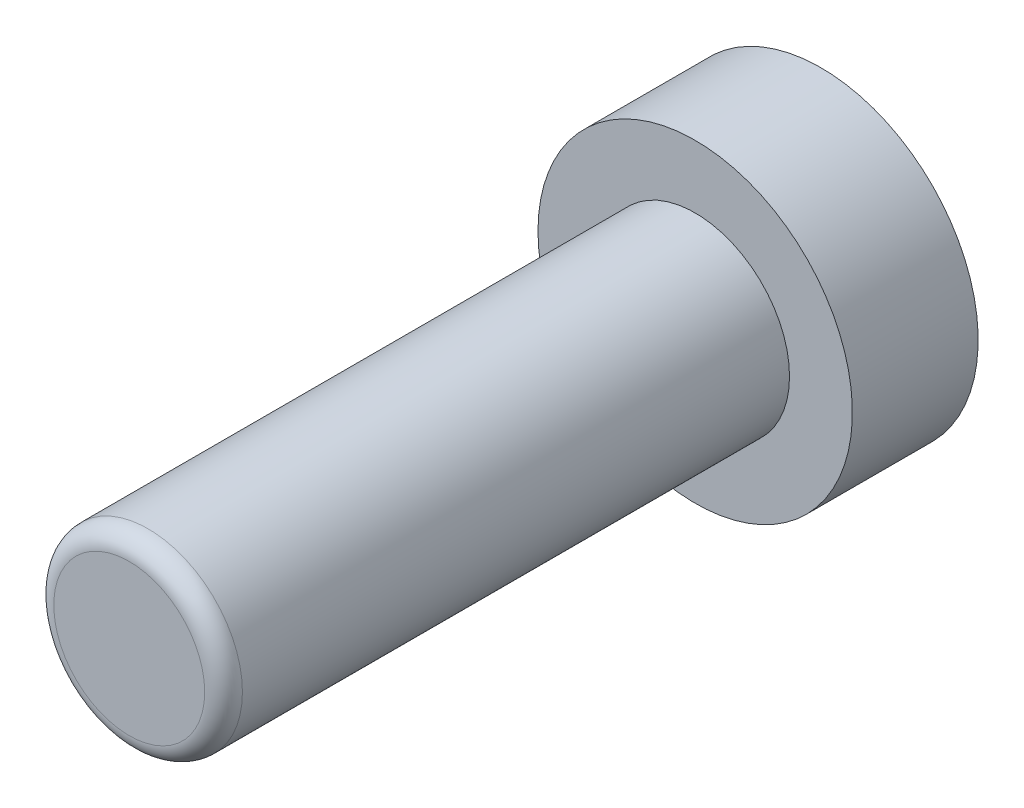
from build123d import *

# Parameters (mm, degrees)
SKETCH1_R           = 1.5
BOSS_EXTRUDE1_DEPTH = 9
SKETCH2_R           = 2.5
BOSS_EXTRUDE2_DEPTH = 2
FILLET2_R           = 0.3


with BuildPart() as part:
    # Sketch1 → Boss-Extrude1 (new body)
    with BuildSketch(Plane.XY):
        Circle(SKETCH1_R)
    extrude(amount=BOSS_EXTRUDE1_DEPTH)

    # Sketch2 → Boss-Extrude2 (add)
    with BuildSketch(Plane(origin=(0, 0, 0), x_dir=(-1, 0, 0), z_dir=(0, 0, -1))):
        Circle(SKETCH2_R)
    extrude(amount=BOSS_EXTRUDE2_DEPTH)

    # Fillet2
    fillet2_edges = [part.edges().sort_by_distance(p)[0] for p in [
        (-1.5, 0, 9),
    ]]
    fillet(fillet2_edges, radius=FILLET2_R)


solid = part.part
